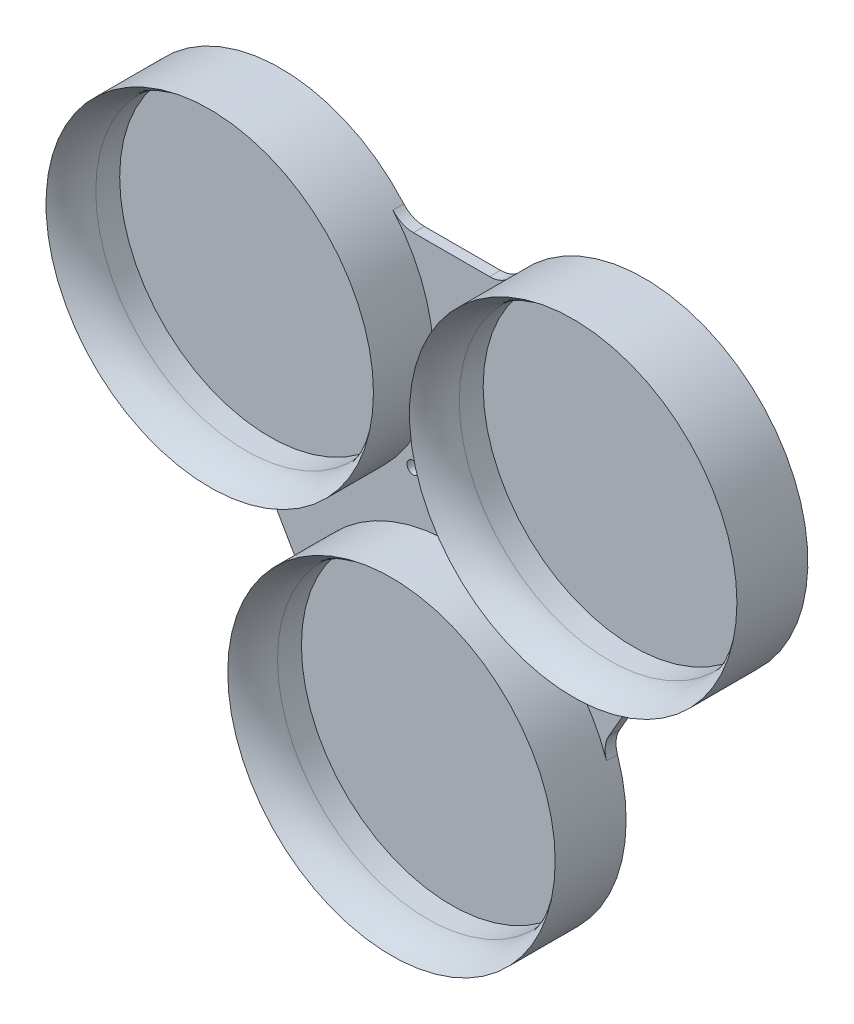
from build123d import *

# Parameters (mm, degrees)
SKETCH_1_R          = 30
SKETCH_1_R_2        = 27.5
EXTRUDE_1_DEPTH     = 13
SKETCH_1_R_3        = 29.999999999999996
EXTRUDE_1_2_DEPTH   = 13
EXTRUDE_1_3_DEPTH   = 13
EXTRUDE_2_DEPTH     = 2
SKETCH_3_R          = 1.149999999999996
SKETCH_3_R_2        = 1.1499999999999966
SKETCH_3_R_3        = 1.1500000000000037
CUT_EXTRUDE_5_DEPTH = 132.10250765535577
FILLET_1_R          = 10
SKETCH_5_R          = 12.500000000000002
SKETCH_5_R_2        = 10.5
EXTRUDE_3_DEPTH     = 7


with BuildPart() as part:
    # 草图1 → 凸台-拉伸1 (new body)
    with BuildSketch(Plane.XY):
        with Locations(Location((0, 0, 0), (0, 0, 180))):
            Circle(SKETCH_1_R)
        with Locations(Location((0, 0, 0), (0, 0, 180))):
            Circle(SKETCH_1_R_2, mode=Mode.SUBTRACT)
    extrude(amount=EXTRUDE_1_DEPTH)



with BuildPart() as body_2:
    # 草图1 → Extrude 1 2 (new body)
    with BuildSketch(Plane.XY):
        with Locations(Location((66.6, 0, 0), (0, 0, 180))):
            Circle(SKETCH_1_R_3)
        with Locations(Location((66.6, 0, 0), (0, 0, 180))):
            Circle(SKETCH_1_R_2, mode=Mode.SUBTRACT)
    extrude(amount=EXTRUDE_1_2_DEPTH)


with BuildPart() as body_3:
    # 草图1 → Extrude 1 3 (new body)
    with BuildSketch(Plane.XY):
        with Locations(Location((33.30000000000001, -57.6772918920436, 0), (0, 0, 180))):
            Circle(SKETCH_1_R_3)
        with Locations(Location((33.30000000000001, -57.6772918920436, 0), (0, 0, 180))):
            Circle(SKETCH_1_R_2, mode=Mode.SUBTRACT)
    extrude(amount=EXTRUDE_1_3_DEPTH)


with BuildPart() as part_1:
    add(part.part)

    add(body_2.part)  # 凸台-拉伸2 merges body 2

    add(body_3.part)  # 凸台-拉伸2 merges body 3
    # 草图2 → 凸台-拉伸2 (add)
    with BuildSketch(Plane.XY):
        with BuildLine():
            Line((26.3198925252566, 18.070831312697457), (40.280107474743396, 18.070831312697457))
            ThreePointArc((40.280107474743396, 18.070831312697457), (42.3441853289733, 18.516758123597654), (44.04009212120862, 19.77499826802639))
            ThreePointArc((44.04009212120862, 19.77499826802639), (92.58076211353317, 15), (72.44569692050842, -29.424952464083248))
            ThreePointArc((72.44569692050842, -29.424952464083248), (70.50807559525407, -30.264530756395246), (69.08985272167097, -31.829111208097117))
            Line((69.08985272167097, -31.829111208097117), (62.10974524692759, -43.91901199664395))
            ThreePointArc((62.10974524692759, -43.91901199664395), (61.46389026628078, -45.92951925924603), (61.70560479929982, -48.027337695986766))
            ThreePointArc((61.70560479929982, -48.027337695986766), (33.300000000000004, -87.6772918920436), (4.894395200700185, -48.02733769598677))
            ThreePointArc((4.894395200700185, -48.02733769598677), (5.13610973371921, -45.92951925924604), (4.4902547530724135, -43.91901199664397))
            Line((4.4902547530724135, -43.91901199664397), (-2.489852721670984, -31.829111208097103))
            ThreePointArc((-2.489852721670984, -31.829111208097103), (-3.9080755952540875, -30.264530756395228), (-5.845696920508439, -29.42495246408323))
            ThreePointArc((-5.845696920508439, -29.42495246408323), (-25.980762113533153, 15.000000000000009), (22.55990787879137, 19.77499826802639))
            ThreePointArc((22.55990787879137, 19.77499826802639), (24.25581467102669, 18.516758123597654), (26.3198925252566, 18.070831312697457))
        make_face()
    extrude(amount=EXTRUDE_2_DEPTH)

    # 草图3 → 切除-拉伸5 (cut, through all)
    with BuildSketch(Plane.XY):
        with Locations(Location((33.3, -19.225763964014533, 0), (0, 0, 180))):
            Circle(SKETCH_3_R)
        with Locations(Location((33.3, -12.225763964014533, 0), (0, 0, 180))):
            Circle(SKETCH_3_R_2)
        with Locations(Location((40.3, -19.225763964014533, 0), (0, 0, 180))):
            Circle(SKETCH_3_R)
        with Locations(Location((33.3, -26.22576396401453, 0), (0, 0, 180))):
            Circle(SKETCH_3_R)
        with Locations(Location((26.299999999999997, -19.225763964014533, 0), (0, 0, 180))):
            Circle(SKETCH_3_R_3)
    extrude(amount=CUT_EXTRUDE_5_DEPTH, mode=Mode.SUBTRACT)

    # 圆角1
    # the kernel refuses this fillet: 10 mm, written as the material it takes off along each edge
    with BuildSketch(Plane(origin=(0, 0, 13), x_dir=(-1, 1.2e-16, 0), z_dir=(1.2e-16, 1, 0))) as fillet_1_piece_1:
        with BuildLine():
            CenterArc((37.5, -6.614378277661482), FILLET_1_R, 138.59037789072914, 41.409622109270856)
            Line((27.5, -6.614378277661482), (27.3, -6.614378277661482))
            Line((27.3, -6.614378277661482), (27.3, 0))
            Line((27.3, 0), (27.5, 0.1999999999999993))
            ThreePointArc((27.5, 0.1999999999999993), (28.75, 0.1999999999999993), (29.85, 0.1322875655532254))
            Line((29.85, 0.1322875655532254), (30, -3.55e-15))
        make_face()
    revolve(axis=Axis((0, 0, 13), (0, 0, 1)), mode=Mode.SUBTRACT)
    with BuildSketch(Plane(origin=(66.6, 0, 13), x_dir=(-1, 1.2e-16, 0), z_dir=(1.2e-16, 1, 0))) as fillet_1_piece_2:
        with BuildLine():
            CenterArc((37.5, -6.614378277661482), FILLET_1_R, 138.59037789072914, 41.409622109270856)
            Line((27.5, -6.614378277661482), (27.299999999999997, -6.614378277661482))
            Line((27.299999999999997, -6.614378277661482), (27.299999999999997, 0))
            Line((27.299999999999997, 0), (27.5, 0.1999999999999993))
            ThreePointArc((27.5, 0.1999999999999993), (28.75, 0.1999999999999993), (29.85, 0.1322875655532254))
            Line((29.85, 0.1322875655532254), (30, -3.55e-15))
        make_face()
    revolve(axis=Axis((66.6, 0, 13), (0, 0, 1)), mode=Mode.SUBTRACT)
    with BuildSketch(Plane(origin=(33.30000000000001, -57.6772918920436, 13), x_dir=(-1, 0, 0), z_dir=(0, 1, 0))) as fillet_1_piece_3:
        with BuildLine():
            CenterArc((37.5, -6.614378277661478), FILLET_1_R, 138.59037789072914, 41.409622109270856)
            Line((27.5, -6.614378277661478), (27.3, -6.614378277661478))
            Line((27.3, -6.614378277661478), (27.3, 0))
            Line((27.3, 0), (27.5, 0.1999999999999993))
            ThreePointArc((27.5, 0.1999999999999993), (28.75, 0.1999999999999993), (29.849999999999998, 0.1322875655532254))
            Line((29.849999999999998, 0.1322875655532254), (30, -3.55e-15))
        make_face()
    revolve(axis=Axis((33.30000000000001, -57.6772918920436, 13), (0, 0, 1)), mode=Mode.SUBTRACT)

    # 草图5 → 凸台-拉伸3 (add)
    with BuildSketch(Plane(origin=(0, 0, 0), x_dir=(-1, 0, 0), z_dir=(0, 0, -1))):
        with Locations(Location((-33.3, -19.225763964014533, 0), (0, 0, 180))):
            Circle(SKETCH_5_R)
        with Locations((-33.3, -19.225763964014533)):
            Circle(SKETCH_5_R_2, mode=Mode.SUBTRACT)
    extrude(amount=EXTRUDE_3_DEPTH)


solid = part_1.part
